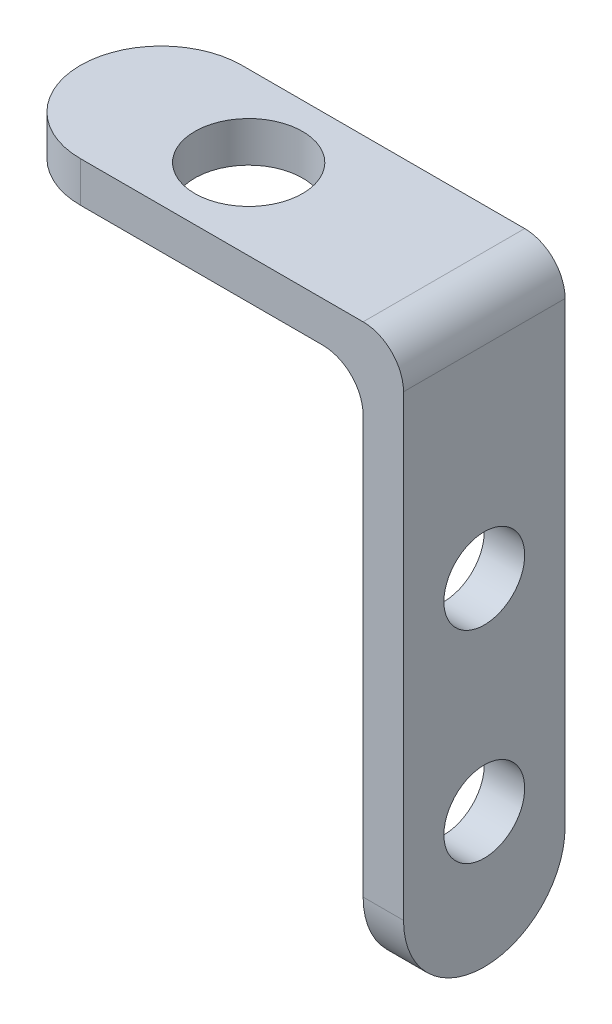
from build123d import *

# Parameters (mm, degrees)
SKETCH1_W           = 30
SKETCH1_H           = 12
BOSS_EXTRUDE1_DEPTH = 3
SKETCH2_W           = 3
SKETCH2_H           = 12
BOSS_EXTRUDE2_DEPTH = 40
FILLET1_R           = 3
FILLET2_R           = 3
SKETCH3_R           = 4
CUT_EXTRUDE1_DEPTH  = 40
SKETCH4_R           = 3
CUT_EXTRUDE3_DEPTH  = 49.631265663
FILLET3_R           = 6
FILLET4_R           = 6


with BuildPart() as part:
    # Sketch1 → Boss-Extrude1 (new body)
    with BuildSketch(Plane(origin=(0, 0, 0), x_dir=(1, 0, 0), z_dir=(0, 1, 0))):
        Rectangle(SKETCH1_W, SKETCH1_H)
    extrude(amount=BOSS_EXTRUDE1_DEPTH)

    # Sketch2 → Boss-Extrude2 (add)
    with BuildSketch(Plane.XZ):
        with Locations((13.5, 0)):
            Rectangle(SKETCH2_W, SKETCH2_H)
    extrude(amount=BOSS_EXTRUDE2_DEPTH)

    # Fillet1
    fillet1_edges = [part.edges().sort_by_distance(p)[0] for p in [
        (15, 3, 0),
    ]]
    fillet(fillet1_edges, radius=FILLET1_R)

    # Fillet2
    fillet2_edges = [part.edges().sort_by_distance(p)[0] for p in [
        (12, 0, 0),
    ]]
    fillet(fillet2_edges, radius=FILLET2_R)

    # Sketch3 → Cut-Extrude1 (cut)
    with BuildSketch(Plane(origin=(0, 3, 0), x_dir=(1, 0, 0), z_dir=(0, 1, 0))):
        with Locations(Location((-2.5, 0, 0), (0, 0, 270))):
            Circle(SKETCH3_R)
    extrude(amount=-CUT_EXTRUDE1_DEPTH, mode=Mode.SUBTRACT)

    # Sketch4 → Cut-Extrude3 (cut, through all)
    with BuildSketch(Plane.ZY.offset(-12)):
        with Locations((0, -15)):
            Circle(SKETCH4_R)
        with Locations((0, -30)):
            Circle(SKETCH4_R)
    extrude(amount=-CUT_EXTRUDE3_DEPTH, mode=Mode.SUBTRACT)

    # Fillet3
    fillet3_edges = [part.edges().sort_by_distance(p)[0] for p in [
        (-15, 1.5, -6),
        (-15, 1.5, 6),
    ]]
    fillet(fillet3_edges, radius=FILLET3_R - 0.0001)  # a hair under: the kernel refuses the full size

    # Fillet4
    fillet4_edges = [part.edges().sort_by_distance(p)[0] for p in [
        (13.5, -40, 6),
        (13.5, -40, -6),
    ]]
    fillet(fillet4_edges, radius=FILLET4_R - 0.0001)  # a hair under: the kernel refuses the full size


solid = part.part
